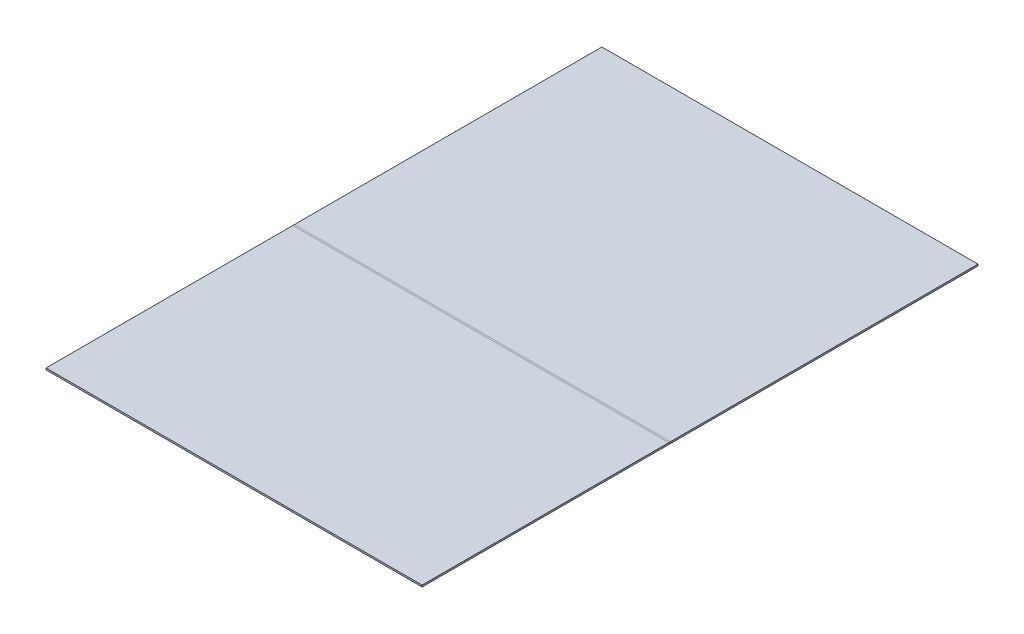
from build123d import *

# Parameters (mm, degrees)
BASE_FLANGE1_DEPTH = 355.6
UNFOLD1_START      = -355.6
UNFOLD1_DEPTH      = 355.6
UNFOLD1_2_DEPTH    = 355.6


# Read off the part's stored shape, not the designer's step: Unfold1
# Sheet-metal steps are written as plain solids
with BuildPart() as part:
    # Sketch1 → Base-Flange1 (new body)
    with BuildSketch(Plane(origin=(0, 0, 0), x_dir=(0, 0, -1), z_dir=(1, 0, 0))):
        with BuildLine():
            Line((0, 0), (-290.758180239, 0))
            ThreePointArc((-290.758180239, 0), (-291.920230239, 0.311370359), (-292.77090988, 1.16205))
            Line((-292.77090988, 1.16205), (-409.417574699, 203.2))
            Line((-409.417574699, 203.2), (-408.042759371, 203.99375))
            Line((-408.042759371, 203.99375), (-291.396094552, 1.9558))
            ThreePointArc((-291.396094552, 1.9558), (-291.126480239, 1.686185688), (-290.758180239, 1.5875))
            Line((-290.758180239, 1.5875), (0, 1.5875))
            Line((0, 1.5875), (0, 0))
        make_face()
    extrude(amount=-BASE_FLANGE1_DEPTH)

    # Unfold1 outline → Unfold1 (cut)
    with BuildSketch(Plane.YZ.offset(UNFOLD1_START)):
        with BuildLine():
            Line((1.5875, 293.016543552), (1.5875, 290.758180239))
            ThreePointArc((1.5875, 290.758180239), (1.686185688, 291.126480239), (1.9558, 291.396094552))
            Line((1.9558, 291.396094552), (203.99375, 408.042759371))
            Line((203.99375, 408.042759371), (203.2, 409.417574699))
            Line((203.2, 409.417574699), (1.5875, 293.016543552))
        make_face()
    extrude(amount=UNFOLD1_DEPTH, mode=Mode.SUBTRACT)

    # Unfold1 2 outline → Unfold1 2 (add)
    with BuildSketch(Plane.YZ.offset(UNFOLD1_START)):
        with BuildLine():
            Line((1.16205, 292.77090988), (1.5875, 293.016543552))
            Line((1.5875, 293.016543552), (1.5875, 525.65408865))
            Line((1.5875, 525.65408865), (0, 525.65408865))
            Line((0, 525.65408865), (0, 290.758180239))
            ThreePointArc((0, 290.758180239), (0.311370359, 291.920230239), (1.16205, 292.77090988))
        make_face()
    extrude(amount=UNFOLD1_2_DEPTH)


solid = part.part
